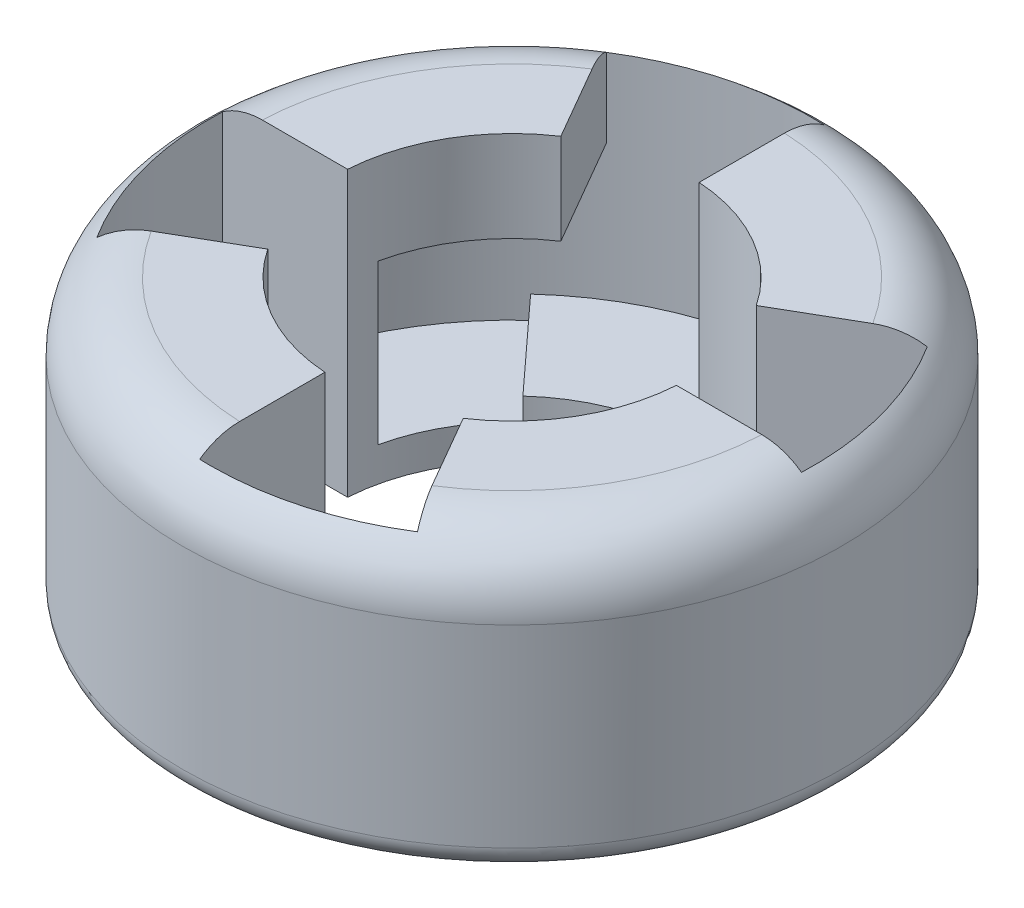
from build123d import *

# Parameters (mm, degrees)
SKETCH2_W          = 6.75
SKETCH2_H          = 12.5
CUT_EXTRUDE1_DEPTH = 10
CIRPATTERN1_COUNT  = 4
CUT_EXTRUDE2_DEPTH = 10
CUT_EXTRUDE3_START = 6
CUT_EXTRUDE3_DEPTH = 7
FILLET1_R          = 3
CUT_EXTRUDE5_START = 6
CUT_EXTRUDE5_DEPTH = 6
CIRPATTERN2_COUNT  = 2
FILLET2_R          = 1


with BuildPart() as part:
    # Sketch2 → Revolve1 (revolve)
    with BuildSketch(Plane(origin=(0, 0, 0), x_dir=(0, 0, -1), z_dir=(1, 0, 0))):
        with Locations((-11.125, 6.25)):
            Rectangle(SKETCH2_W, SKETCH2_H)
    revolve(axis=Axis((0, 31, 0), (0, -1, 0)))

    # Sketch3 → Cut-Extrude1 (cut)
    with BuildSketch(Plane(origin=(0, 12.5, 0), x_dir=(1, 0, 0), z_dir=(0, 1, 0))):
        with BuildLine():
            Line((-7.05329404, 11.216663639), (0.5, -1.866025404))
            Line((0.5, -1.866025404), (0.5, 13.240562677))
            ThreePointArc((0.5, 13.240562677), (-3.429352348, 12.798517198), (-7.05329404, 11.216663639))
        make_face()
    cut_extrude1 = extrude(amount=-CUT_EXTRUDE1_DEPTH, mode=Mode.SUBTRACT)

    # CirPattern1: Cut-Extrude1 ×4 about axis
    cirpattern1_axis = Axis((0, 0, 0), (0, 1, 0))
    for i in range(1, CIRPATTERN1_COUNT):
        add(cut_extrude1.rotate(cirpattern1_axis, i * 360 / CIRPATTERN1_COUNT), mode=Mode.SUBTRACT)

    # Sketch4 → Cut-Extrude2 (cut)
    with BuildSketch(Plane(origin=(0, 2.5, 0), x_dir=(1, 0, 0), z_dir=(0, 1, 0))):
        with BuildLine():
            Line((-7.733854149, 0.5), (-13.240562677, 0.5))
            ThreePointArc((-13.240562677, 0.5), (-12.798517198, -3.429352348), (-11.216663639, -7.05329404))
            Line((-11.216663639, -7.05329404), (-6.447714162, -4.299939776))
            ThreePointArc((-6.447714162, -4.299939776), (-7.485925154, -2.0058476), (-7.733854149, 0.5))
        make_face()
    cut_extrude2 = extrude(amount=-CUT_EXTRUDE2_DEPTH, mode=Mode.SUBTRACT)

    # Sketch5 → Cut-Extrude3 (cut)
    with BuildSketch(Plane(origin=(0, 2.5, 0), x_dir=(1, 0, 0), z_dir=(0, 1, 0)).offset(CUT_EXTRUDE3_START)):
        with BuildLine():
            Line((0, 0), (-8.951570251, 9.768924713))
            ThreePointArc((-8.951570251, 9.768924713), (-11.4748366, 6.625), (-12.935922094, 2.867824885))
            Line((-12.935922094, 2.867824885), (0, 0))
        make_face()
    cut_extrude3 = extrude(amount=-CUT_EXTRUDE3_DEPTH, mode=Mode.SUBTRACT)

    # Fillet1
    # the kernel refuses this fillet: 3 mm, written as the material it takes off along each edge
    with BuildSketch(Plane(origin=(0, 12.5, 0), x_dir=(0, 0, 1), z_dir=(1, 0, 0))) as fillet1_piece_1:
        with BuildLine():
            CenterArc((14.5 - FILLET1_R, FILLET1_R), FILLET1_R, 270, 90)
            Line((14.5 - FILLET1_R, 0), (14.5, 0))
            Line((14.5, 0), (14.5, FILLET1_R))
        make_face()
    revolve(axis=Axis((0, 12.5, 0), (0, -1, 0)), mode=Mode.SUBTRACT)

    # Sketch8 → Cut-Extrude5 (cut)
    with BuildSketch(Plane(origin=(0, 2.5, 0), x_dir=(1, 0, 0), z_dir=(0, 1, 0)).offset(CUT_EXTRUDE5_START)):
        with BuildLine():
            Line((-4.299939776, 6.447714162), (-7.05329404, 11.216663639))
            ThreePointArc((-7.05329404, 11.216663639), (-8.035104682, 10.535634426), (-8.951570251, 9.768924713))
            Line((-8.951570251, 9.768924713), (-5.235824109, 5.71389936))
            ThreePointArc((-5.235824109, 5.71389936), (-4.781978593, 6.098785186), (-4.299939776, 6.447714162))
        make_face()
    cut_extrude5 = extrude(amount=-CUT_EXTRUDE5_DEPTH, mode=Mode.SUBTRACT)

    # CirPattern2: Cut-Extrude2, Cut-Extrude3, Cut-Extrude5 ×2 about axis
    cirpattern2_axis = Axis((0, 0, 0), (0, 1, 0))
    add([cut_extrude2.rotate(cirpattern2_axis, i * 360 / CIRPATTERN2_COUNT) for i in range(1, CIRPATTERN2_COUNT)], mode=Mode.SUBTRACT)
    add([cut_extrude3.rotate(cirpattern2_axis, i * 360 / CIRPATTERN2_COUNT) for i in range(1, CIRPATTERN2_COUNT)], mode=Mode.SUBTRACT)
    add([cut_extrude5.rotate(cirpattern2_axis, i * 360 / CIRPATTERN2_COUNT) for i in range(1, CIRPATTERN2_COUNT)], mode=Mode.SUBTRACT)

    # Fillet2
    fillet2_edges = [part.edges().sort_by_distance(p)[0] for p in [
        (0, 0, -14.5),
    ]]
    fillet(fillet2_edges, radius=FILLET2_R)


solid = part.part
